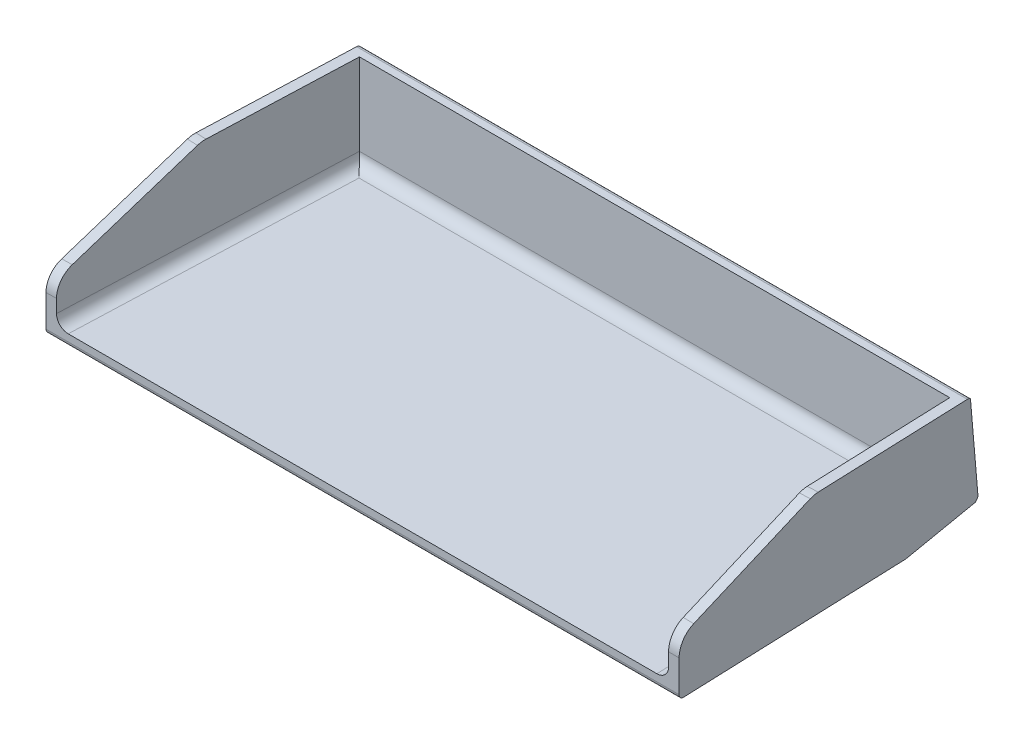
from build123d import *

# Parameters (mm, degrees)
SKETCH1_W           = 272
SKETCH1_H           = 134
BOSS_EXTRUDE2_DEPTH = 45
CUT_EXTRUDE8_DEPTH  = 300
CUT_EXTRUDE10_DEPTH = 300
CUT_EXTRUDE11_DEPTH = 40
CUT_EXTRUDE12_DEPTH = 5
CUT_EXTRUDE13_DEPTH = 5
FILLET1_R           = 10
FILLET2_R           = 5
FILLET3_R           = 10
FILLET5_R           = 2
FILLET6_R           = 2
FILLET7_R           = 2
BOSS_EXTRUDE3_DEPTH = 5
SKETCH18_W          = 22.005693375
SKETCH18_H          = 61.946637546
BOSS_EXTRUDE4_DEPTH = 5
SKETCH19_W          = 26.164660497
SKETCH19_H          = 10
BOSS_EXTRUDE5_DEPTH = 15
CUT_EXTRUDE15_DEPTH = 350
SKETCH22_W          = 22.005693375
SKETCH22_H          = 61.946637546
CUT_EXTRUDE16_DEPTH = 350
CUT_EXTRUDE17_DEPTH = 350
SKETCH26_W          = 366.999535542
SKETCH26_H          = 253.064882437
CUT_EXTRUDE18_DEPTH = 5
FILLET8_R           = 5
SKETCH27_W          = 167.245030015
SKETCH27_H          = 61.468608264
CUT_EXTRUDE19_DEPTH = 0.5
SKETCH28_W          = 245.78388014
SKETCH28_H          = 90.598055895
CUT_EXTRUDE20_DEPTH = 0.5
SKETCH29_W          = 367.28533999
SKETCH29_H          = 77.687990399
CUT_EXTRUDE21_DEPTH = 0.5


with BuildPart() as part:
    # Sketch1 → Boss-Extrude2 (new body)
    with BuildSketch(Plane(origin=(0, 0, 0), x_dir=(1, 0, 0), z_dir=(0, 1, 0))):
        with Locations((136, 67)):
            Rectangle(SKETCH1_W, SKETCH1_H)
    extrude(amount=BOSS_EXTRUDE2_DEPTH)

    # Sketch8 → Cut-Extrude8 (cut)
    with BuildSketch(Plane.ZY):
        Polygon((-134, 45), (-130, 45), (-134, 0), align=None)
    extrude(amount=-CUT_EXTRUDE8_DEPTH, mode=Mode.SUBTRACT)

    # Sketch9 → Cut-Extrude10 (cut)
    with BuildSketch(Plane.XZ):
        Polygon((0, -134), (5, -134), (0, 0), align=None)
        Polygon((272, -134), (267, -134), (272, 0), align=None)
    extrude(amount=-CUT_EXTRUDE10_DEPTH, mode=Mode.SUBTRACT)

    # Sketch11 → Cut-Extrude11 (cut)
    with BuildSketch(Plane(origin=(0, 45, 0), x_dir=(1, 0, 0), z_dir=(0, 1, 0))):
        Polygon((9.664179104, 125), (262.335820896, 125), (267, 0), (5, 0), align=None)
    extrude(amount=-CUT_EXTRUDE11_DEPTH, mode=Mode.SUBTRACT)

    # Sketch12 → Cut-Extrude12 (cut)
    with BuildSketch(Plane(origin=(0, 0, 0), x_dir=(-0.037287484326558824, 0, 0.9993045799517766), z_dir=(-0.9993045799517766, 0, -0.037287484326558824))):
        Polygon((0, 22.5), (-60.090467519, 45), (0, 45), align=None)
    extrude(amount=-CUT_EXTRUDE12_DEPTH, mode=Mode.SUBTRACT)

    # Sketch13 → Cut-Extrude13 (cut)
    with BuildSketch(Plane(origin=(271.621823035, 0, -10.135142651), x_dir=(-0.03728748432655886, 0, -0.9993045799517766), z_dir=(0.9993045799517766, 0, -0.03728748432655886))):
        Polygon((-10.142195737, 22.5), (49.948271782, 45), (-10.142195737, 45), align=None)
    extrude(amount=-CUT_EXTRUDE13_DEPTH, mode=Mode.SUBTRACT)

    # Fillet1
    fillet1_edges = [part.edges().sort_by_distance(p)[0] for p in [
        (2.5, 22.534904388, 0),
        (269.5, 22.534904388, 0),
    ]]
    fillet(fillet1_edges, radius=FILLET1_R)

    # Fillet2
    fillet2_edges = [part.edges().sort_by_distance(p)[0] for p in [
        (7.332089552, 5, -62.5),
        (136, 5, -125),
        (264.667910448, 5, -62.5),
    ]]
    fillet(fillet2_edges, radius=FILLET2_R)

    # Fillet3
    fillet3_edges = [part.edges().sort_by_distance(p)[0] for p in [
        (4.737146475, 45, -59.955525519),
        (267.262853525, 45, -59.955525519),
    ]]
    fillet(fillet3_edges, radius=FILLET3_R)

    # Fillet5
    fillet5_edges = [part.edges().sort_by_distance(p)[0] for p in [
        (136, 0, 0),
    ]]
    fillet(fillet5_edges, radius=FILLET5_R)

    # Fillet6
    fillet6_edges = [part.edges().sort_by_distance(p)[0] for p in [
        (136, 0, -134),
    ]]
    fillet(fillet6_edges, radius=FILLET6_R)

    # Fillet7
    fillet7_edges = [part.edges().sort_by_distance(p)[0] for p in [
        (136, 45, -130),
    ]]
    fillet(fillet7_edges, radius=FILLET7_R)

    # Sketch17 → Boss-Extrude3 (add)
    with BuildSketch(Plane.XZ):
        Polygon((0, 0), (242.409497269, 0), (294.229063893, 0), (294.229063893, -131.814336534), (242.409497269, -131.814336534), (0, -131.814336534), align=None)
    extrude(amount=BOSS_EXTRUDE3_DEPTH)

    # Sketch18 → Boss-Extrude4 (add)
    with BuildSketch(Plane(origin=(0, 0, 0), x_dir=(1, 0, 0), z_dir=(0, 1, 0))):
        with Locations((283.226217206, 100.841017761)):
            Rectangle(SKETCH18_W, SKETCH18_H)
    extrude(amount=BOSS_EXTRUDE4_DEPTH)

    # Sketch19 → Boss-Extrude5 (add)
    with BuildSketch(Plane(origin=(0, 0, -131.814336534), x_dir=(-1, 0, 0), z_dir=(0, 0, -1))):
        with Locations((-281.146733645, 0)):
            Rectangle(SKETCH19_W, SKETCH19_H)
    extrude(amount=BOSS_EXTRUDE5_DEPTH)

    # Sketch21 → Cut-Extrude15 (cut)
    with BuildSketch(Plane(origin=(294.229063893, 0, 0), x_dir=(0, 0, -1), z_dir=(1, 0, 0))):
        Polygon((69.867698988, -5), (131.814336534, 5), (146.814336534, 5), (146.814336534, -5), align=None)
    extrude(amount=-CUT_EXTRUDE15_DEPTH, mode=Mode.SUBTRACT)

    # Sketch22 → Cut-Extrude16 (cut)
    with BuildSketch(Plane(origin=(0, 5, 0), x_dir=(1, 0, 0), z_dir=(0, 1, 0))):
        with Locations((283.226217206, 100.841017761)):
            Rectangle(SKETCH22_W, SKETCH22_H)
    extrude(amount=-CUT_EXTRUDE16_DEPTH, mode=Mode.SUBTRACT)

    # Sketch24 → Cut-Extrude17 (cut)
    with BuildSketch(Plane(origin=(0, 0, 0), x_dir=(1, 0, 0), z_dir=(0, 1, 0))):
        Polygon((294.229063893, 69.867698988), (272.223370518, 69.867698988), (272.223370518, 100.841017761), (268.237275457, 100.841017761), (271.925373134, 2), (271.925373134, 0), (294.229063893, 0), align=None)
    extrude(amount=-CUT_EXTRUDE17_DEPTH, mode=Mode.SUBTRACT)

    # Sketch26 → Cut-Extrude18 (cut)
    with BuildSketch(Plane.XZ.offset(5)):
        with Locations((88.425605363, -126.532441219)):
            Rectangle(SKETCH26_W, SKETCH26_H)
    extrude(amount=-CUT_EXTRUDE18_DEPTH, mode=Mode.SUBTRACT)

    # Fillet8
    # the kernel refuses this fillet: 5 mm, written as the material it takes off along each edge
    with BuildSketch(Plane(origin=(276.867640222, 5, -133.555555556), x_dir=(0, 0.996072640692687, 0.08853979028378928), z_dir=(-1, 0, 0))) as fillet8_piece_1:
        with BuildLine():
            CenterArc((3.94042259, -5), FILLET8_R, 90, 49.222455221)
            Line((0.154167167, -1.734380629), (0.078442059, -1.669068242))
            ThreePointArc((0.078442059, -1.669068242), (-0.022523681, -0.876044294), (-0.099607264, -0.008853979))
            Line((-0.099607264, -0.008853979), (0, 0.1))
            Line((0, 0.1), (3.94042259, 0.1))
            Line((3.94042259, 0.1), (3.94042259, 0))
        make_face()
    extrude(amount=281.735280444, mode=Mode.SUBTRACT)

    # Sketch27 → Cut-Extrude19 (cut)
    with BuildSketch(Plane(origin=(271.621823035, 0, -10.135142651), x_dir=(-0.03728748432655886, 0, -0.9993045799517766), z_dir=(0.9993045799517766, 0, -0.03728748432655886))):
        with Locations((55.876182623, 22.646622557)):
            Rectangle(SKETCH27_W, SKETCH27_H)
    extrude(amount=-CUT_EXTRUDE19_DEPTH, mode=Mode.SUBTRACT)

    # Sketch28 → Cut-Extrude20 (cut)
    with BuildSketch(Plane(origin=(0, 0, 0), x_dir=(-0.037287484326558824, 0, 0.9993045799517766), z_dir=(-0.9993045799517766, 0, -0.037287484326558824))):
        with Locations((-84.953882452, 20.133440951)):
            Rectangle(SKETCH28_W, SKETCH28_H)
    extrude(amount=-CUT_EXTRUDE20_DEPTH, mode=Mode.SUBTRACT)

    # Sketch29 → Cut-Extrude21 (cut)
    with BuildSketch(Plane(origin=(0, 11.817736404, -132.949534542), x_dir=(-1, 0, 0), z_dir=(0, 0.08853979028379444, -0.9960726406926865))):
        with Locations((-152.32774441, 16.969098034)):
            Rectangle(SKETCH29_W, SKETCH29_H)
    extrude(amount=-CUT_EXTRUDE21_DEPTH, mode=Mode.SUBTRACT)


solid = part.part
